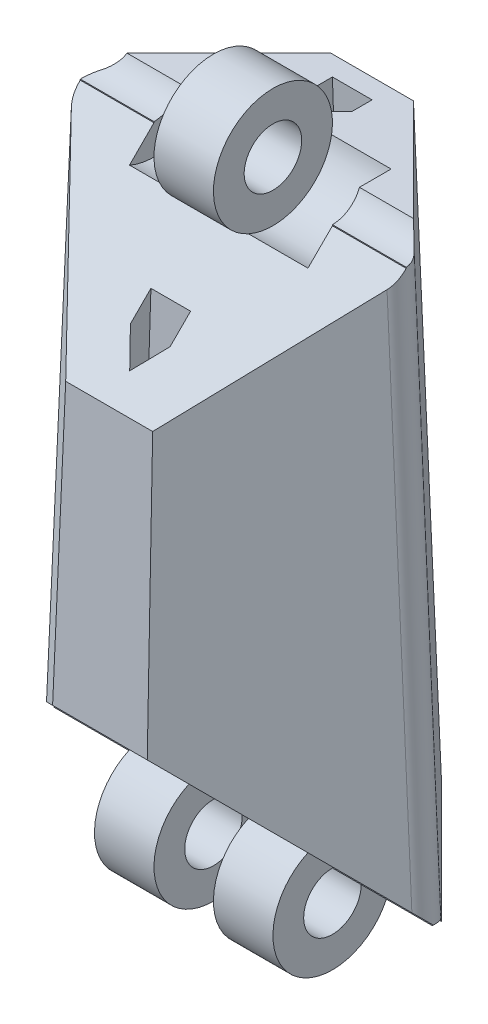
from build123d import *

# Parameters (mm, degrees)
LOFT1_DEPTH             = 30
LOFT1_DRAFT             = 1.9091524
CUT_EXTRUDE2_DEPTH      = 33.499999989
CUT_EXTRUDE2_DEPTH_BACK = 33.499999989
FILLET5_R               = 1
SKETCH4_R               = 3
BOSS_EXTRUDE1_DEPTH     = 1.5
CUT_EXTRUDE3_START      = 3
SKETCH5_R               = 3
CUT_EXTRUDE3_DEPTH      = 3
SKETCH7_R               = 3
CUT_EXTRUDE5_DEPTH      = 1.5
BOSS_EXTRUDE2_START     = -3
SKETCH8_R               = 3
BOSS_EXTRUDE2_DEPTH     = 3
CUT_EXTRUDE6_DEPTH      = 23.235565384
CUT_EXTRUDE6_DEPTH_BACK = 23.235565384
CUT_EXTRUDE7_DEPTH      = 23.523598989
CUT_EXTRUDE7_DEPTH_BACK = 23.523598989
CUT_EXTRUDE8_DEPTH      = 36.642580329
CUT_EXTRUDE8_DEPTH_BACK = 36.642580329
SKETCH11_R              = 1.45


# Read off the part's stored shape, not the designer's step: Loft1
with BuildPart() as part:
    # Loft1 outline → Loft1 (with draft: the straight prism first)
    with BuildSketch(Plane(origin=(0, 30, 0), x_dir=(1, 0, 0), z_dir=(0, 1, 0))):
        Polygon((2.085786438, 6.5), (-2.085786438, 6.5), (-8.585786438, 0), (-2.085786438, -6.5), (2.085786438, -6.5), (8.585786438, 0), align=None)
    extrude(amount=-LOFT1_DEPTH)
    # Loft1: the draft: its side faces are tilted about the plane it starts from
    loft1_sides = [part.faces().sort_by_distance(p)[0] for p in [
        (0, 15, -6.5),
        (-5.335786438, 15, -3.25),
        (-5.335786438, 15, 3.25),
        (0, 15, 6.5),
        (5.335786438, 15, 3.25),
        (5.335786438, 15, -3.25),
    ]]
    draft(loft1_sides, Plane(origin=(0, 30, 0), x_dir=(1, 0, 0), z_dir=(0, 1, 0)), LOFT1_DRAFT)

    # Sketch3 → Cut-Extrude2 (cut, two sides: drawn at the far end of the back side and taken through both)
    with BuildSketch(Plane(origin=(0, 0, 0), x_dir=(0, 0, -1), z_dir=(1, 0, 0)).offset(-CUT_EXTRUDE2_DEPTH_BACK)):
        Polygon((0, 30), (0, 29), (-6.75862069, 22.24137931), (-6.5, 30), align=None)
        Polygon((0, 0), (0, 1), (-7.225806452, 8.225806452), (-7.5, 0), align=None)
    extrude(amount=CUT_EXTRUDE2_DEPTH + CUT_EXTRUDE2_DEPTH_BACK, mode=Mode.SUBTRACT)

    # Fillet5
    # the kernel refuses this fillet: 1 mm, written as the material it takes off along each edge
    with BuildSketch(Plane(origin=(8.515337072, 31.494456763, 0), x_dir=(-0.7059303394201505, -0.033277874761044414, -0.7074990734534847), z_dir=(0.04708816012216718, -0.9988907373563483, 0))) as fillet5_piece_1:
        with BuildLine():
            CenterArc((FILLET5_R * 0.998890737356, -FILLET5_R), FILLET5_R, 90, 89.936408669)
            Line((-FILLET5_R * 0.00110864672901, -FILLET5_R * 0.998890122125), (0, 0))
            Line((0, 0), (FILLET5_R * 0.998890737356, 0))
        make_face()
    extrude(amount=33.025547532, mode=Mode.SUBTRACT)
    with BuildSketch(Plane(origin=(-8.515337072, 31.494456763, 0), x_dir=(0.7059303394201496, -0.03327787476104438, -0.7074990734534856), z_dir=(-0.04708816012216718, -0.9988907373563483, 0))) as fillet5_piece_2:
        with BuildLine():
            CenterArc((FILLET5_R * 0.998890737356, FILLET5_R), FILLET5_R, 180.063591331, 89.936408669)
            Line((-FILLET5_R * 0.00110864672902, FILLET5_R * 0.998890122125), (0, 0))
            Line((0, 0), (FILLET5_R * 0.998890737356, 0))
        make_face()
    extrude(amount=33.025547532, mode=Mode.SUBTRACT)

    # Sketch4 → Boss-Extrude1 (add, symmetric)
    with BuildSketch(Plane(origin=(0, 0, 0), x_dir=(0, 0, -1), z_dir=(1, 0, 0))):
        with Locations((0, 30.5)):
            Circle(SKETCH4_R)
    extrude(amount=BOSS_EXTRUDE1_DEPTH, both=True)

    # Sketch5 → Cut-Extrude3 (cut)
    with BuildSketch(Plane(origin=(1.5, 0, 0), x_dir=(0, 0, -1), z_dir=(1, 0, 0)).offset(CUT_EXTRUDE3_START)):
        with Locations((0, 30.5)):
            Circle(SKETCH5_R)
    cut_extrude3 = extrude(amount=-CUT_EXTRUDE3_DEPTH, mode=Mode.SUBTRACT)

    # Mirror1: Cut-Extrude3 across plane
    add(cut_extrude3.mirror(Plane(origin=(0, 0, 0), x_dir=(0, 0, 1), z_dir=(1, 0, 0))), mode=Mode.SUBTRACT)

    # Sketch7 → Cut-Extrude5 (cut, symmetric)
    with BuildSketch(Plane(origin=(0, 0, 0), x_dir=(0, 0, -1), z_dir=(1, 0, 0))):
        with Locations((0, -0.5)):
            Circle(SKETCH7_R)
    extrude(amount=CUT_EXTRUDE5_DEPTH, both=True, mode=Mode.SUBTRACT)

    # Sketch8 → Boss-Extrude2 (add)
    with BuildSketch(Plane.ZY.offset(-1.5).offset(BOSS_EXTRUDE2_START)):
        with Locations((0, -0.5)):
            Circle(SKETCH8_R)
    boss_extrude2 = extrude(amount=BOSS_EXTRUDE2_DEPTH)

    # Mirror2: Boss-Extrude2 across plane
    add(boss_extrude2.mirror(Plane(origin=(0, 0, 0), x_dir=(0, 0, 1), z_dir=(1, 0, 0))))

    # Sketch9 → Cut-Extrude6 (cut, two sides: drawn at the far end of the back side and taken through both)
    with BuildSketch(Plane(origin=(0, 14.98387035, -0.499462345), x_dir=(1, 0, 0), z_dir=(0, 0.9994449069791544, -0.03331483023263851)).offset(-CUT_EXTRUDE6_DEPTH_BACK)):
        Polygon((-1, -4.495836802), (1, -4.495836802), (1, -5.495836802), (0, -6.495836802), (-1, -5.495836802), align=None)
    extrude(amount=CUT_EXTRUDE6_DEPTH + CUT_EXTRUDE6_DEPTH_BACK, mode=Mode.SUBTRACT)

    # Sketch10 → Cut-Extrude7 (cut, two sides: drawn at the far end of the back side and taken through both)
    with BuildSketch(Plane(origin=(0, 14.750277469, 0.491675916), x_dir=(1, 0, 0), z_dir=(0, 0.9994449069791544, 0.03331483023263851)).offset(-CUT_EXTRUDE7_DEPTH_BACK)):
        Polygon((-1, 6.495836802), (1, 6.495836802), (1, 5.495836802), (0, 4.495836802), (-1, 5.495836802), align=None)
    extrude(amount=CUT_EXTRUDE7_DEPTH + CUT_EXTRUDE7_DEPTH_BACK, mode=Mode.SUBTRACT)

    # Sketch11 → Cut-Extrude8 (cut, two sides: drawn at the far end of the back side and taken through both)
    with BuildSketch(Plane(origin=(0, 0, 0), x_dir=(0, 0, -1), z_dir=(1, 0, 0)).offset(-CUT_EXTRUDE8_DEPTH_BACK)):
        with Locations((0, 30.5)):
            Circle(SKETCH11_R)
        with Locations((0, -0.5)):
            Circle(SKETCH11_R)
    extrude(amount=CUT_EXTRUDE8_DEPTH + CUT_EXTRUDE8_DEPTH_BACK, mode=Mode.SUBTRACT)


solid = part.part
